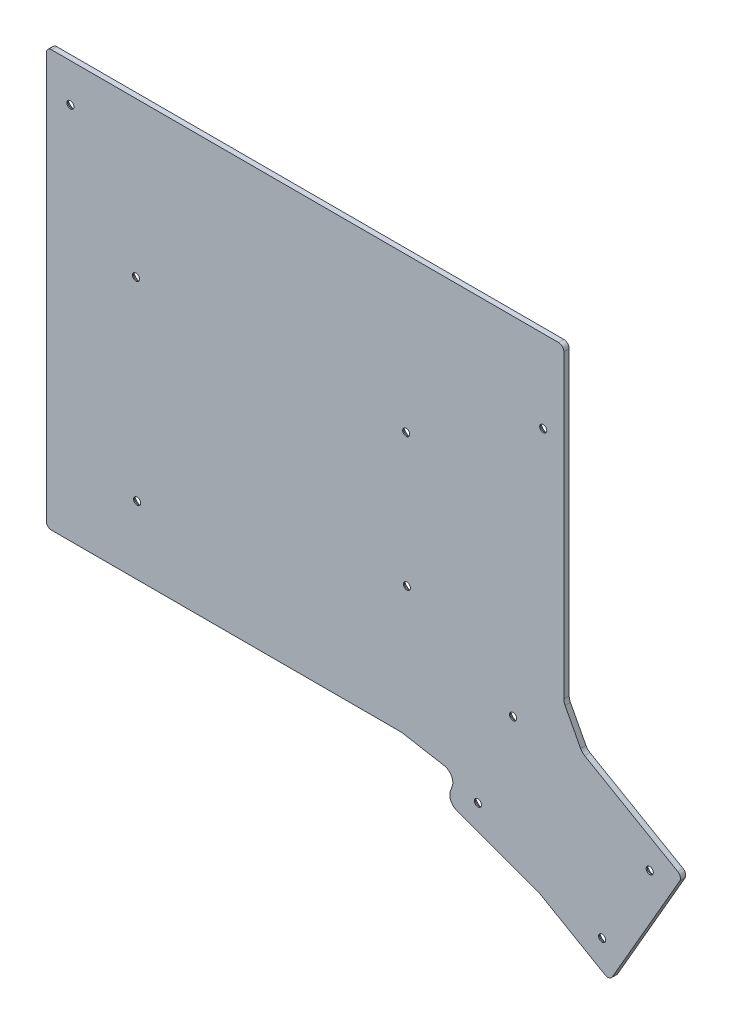
from build123d import *

# Parameters (mm, degrees)
BOSS_EXTRUDE1_DEPTH = 1.5
SKETCH6_R           = 1
CUT_EXTRUDE1_DEPTH  = 10
FILLET4_R           = 1.5
FILLET5_R           = 3


# Read off the part's stored shape, not the designer's step: AdvancedHole1
with BuildPart() as part:
    # Sketch1 → Boss-Extrude1 (new body)
    with BuildSketch(Plane.XY):
        Polygon((-132.514999879, 63.173696093), (13.284995002, 63.173696093), (13.284995002, -23.784888353), (18.416457767, -33.534813854), (46.668669763, -49.846236055), (26.202746282, -85.294255348), (6.148371034, -73.7158564), (-19.700470814, -64.307647377), (-16.953396025, -56.760121426), (-32.457645619, -54.026303907), (-132.514999879, -54.026303907), align=None)
    extrude(amount=BOSS_EXTRUDE1_DEPTH)

    # Sketch6 → Cut-Extrude1 (cut)
    with BuildSketch(Plane(origin=(0, 0, 0), x_dir=(-1, 0, 0), z_dir=(0, 0, -1))):
        with Locations((125.729523879, 52.403696093)):
            Circle(SKETCH6_R)
        with Locations((106.929523879, -34.896303907)):
            Circle(SKETCH6_R)
        with Locations((30.929523879, -17.596303907)):
            Circle(SKETCH6_R)
        with Locations((31.129523879, 19.803696093)):
            Circle(SKETCH6_R)
        with Locations((-7.470476121, 40.003696093)):
            Circle(SKETCH6_R)
        with Locations((1.029523879, -34.496303907)):
            Circle(SKETCH6_R)
        with Locations((10.929523879, -60.496303907)):
            Circle(SKETCH6_R)
        with Locations((-37.470476121, -52.796303907)):
            Circle(SKETCH6_R)
        with Locations((-24.070476121, -75.996303907)):
            Circle(SKETCH6_R)
        with Locations((107.229523879, 19.603696093)):
            Circle(SKETCH6_R)
    extrude(amount=-CUT_EXTRUDE1_DEPTH, mode=Mode.SUBTRACT)

    # AdvancedHole1 outline → AdvancedHole1 (revolve, cut)
    with BuildSketch(Plane(origin=(37.470476121, -52.796303907, 0), x_dir=(1, 0, 0), z_dir=(0, -1, 0))):
        Polygon((2.2, 0), (1, 1.2), (1, 0), align=None)
    revolve(axis=Axis((37.470476121, -52.796303907, 0), (0, 0, 1)), mode=Mode.SUBTRACT)

    # AdvancedHole1 2 outline → AdvancedHole1 2 (revolve, cut)
    with BuildSketch(Plane(origin=(24.070476121, -75.996303907, 0), x_dir=(1, 0, 0), z_dir=(0, -1, 0))):
        Polygon((2.2, 0), (1, 1.2), (1, 0), align=None)
    revolve(axis=Axis((24.070476121, -75.996303907, 0), (0, 0, 1)), mode=Mode.SUBTRACT)

    # AdvancedHole1 3 outline → AdvancedHole1 3 (revolve, cut)
    with BuildSketch(Plane(origin=(-10.929523879, -60.496303907, 0), x_dir=(1, 0, 0), z_dir=(0, -1, 0))):
        Polygon((2.2, 0), (1, 1.2), (1, 0), align=None)
    revolve(axis=Axis((-10.929523879, -60.496303907, 0), (0, 0, 1)), mode=Mode.SUBTRACT)

    # AdvancedHole1 4 outline → AdvancedHole1 4 (revolve, cut)
    with BuildSketch(Plane(origin=(-1.029523879, -34.496303907, 0), x_dir=(1, 0, 0), z_dir=(0, -1, 0))):
        Polygon((2.2, 0), (1, 1.2), (1, 0), align=None)
    revolve(axis=Axis((-1.029523879, -34.496303907, 0), (0, 0, 1)), mode=Mode.SUBTRACT)

    # AdvancedHole1 5 outline → AdvancedHole1 5 (revolve, cut)
    with BuildSketch(Plane(origin=(-30.929523879, -17.596303907, 0), x_dir=(1, 0, 0), z_dir=(0, -1, 0))):
        Polygon((2.2, 0), (1, 1.2), (1, 0), align=None)
    revolve(axis=Axis((-30.929523879, -17.596303907, 0), (0, 0, 1)), mode=Mode.SUBTRACT)

    # AdvancedHole1 6 outline → AdvancedHole1 6 (revolve, cut)
    with BuildSketch(Plane(origin=(-106.929523879, -34.896303907, 0), x_dir=(1, 0, 0), z_dir=(0, -1, 0))):
        Polygon((2.2, 0), (1, 1.2), (1, 0), align=None)
    revolve(axis=Axis((-106.929523879, -34.896303907, 0), (0, 0, 1)), mode=Mode.SUBTRACT)

    # AdvancedHole1 7 outline → AdvancedHole1 7 (revolve, cut)
    with BuildSketch(Plane(origin=(-125.729523879, 52.403696093, 0), x_dir=(1, 0, 0), z_dir=(0, -1, 0))):
        Polygon((2.2, 0), (1, 1.2), (1, 0), align=None)
    revolve(axis=Axis((-125.729523879, 52.403696093, 0), (0, 0, 1)), mode=Mode.SUBTRACT)

    # AdvancedHole1 8 outline → AdvancedHole1 8 (revolve, cut)
    with BuildSketch(Plane(origin=(-31.129523879, 19.803696093, 0), x_dir=(1, 0, 0), z_dir=(0, -1, 0))):
        Polygon((2.2, 0), (1, 1.2), (1, 0), align=None)
    revolve(axis=Axis((-31.129523879, 19.803696093, 0), (0, 0, 1)), mode=Mode.SUBTRACT)

    # AdvancedHole1 9 outline → AdvancedHole1 9 (revolve, cut)
    with BuildSketch(Plane(origin=(-107.229523879, 19.603696093, 0), x_dir=(1, 0, 0), z_dir=(0, -1, 0))):
        Polygon((2.2, 0), (1, 1.2), (1, 0), align=None)
    revolve(axis=Axis((-107.229523879, 19.603696093, 0), (0, 0, 1)), mode=Mode.SUBTRACT)

    # AdvancedHole1 10 outline → AdvancedHole1 10 (revolve, cut)
    with BuildSketch(Plane(origin=(7.470476121, 40.003696093, 0), x_dir=(1, 0, 0), z_dir=(0, -1, 0))):
        Polygon((2.2, 0), (1, 1.2), (1, 0), align=None)
    revolve(axis=Axis((7.470476121, 40.003696093, 0), (0, 0, 1)), mode=Mode.SUBTRACT)

    # Fillet4
    fillet4_edges = [part.edges().sort_by_distance(p)[0] for p in [
        (-132.514999879, 63.173696093, 0.75),
        (13.284995002, 63.173696093, 0.75),
        (46.668669763, -49.846236055, 0.75),
        (26.202746282, -85.294255348, 0.75),
        (-132.514999879, -54.026303907, 0.75),
    ]]
    fillet(fillet4_edges, radius=FILLET4_R)

    # Fillet5
    fillet5_edges = [part.edges().sort_by_distance(p)[0] for p in [
        (13.284995002, -23.784888353, 0.75),
        (18.416457767, -33.534813854, 0.75),
        (-19.700470814, -64.307647377, 0.75),
        (-16.953396025, -56.760121426, 0.75),
        (-32.457645619, -54.026303907, 0.75),
    ]]
    fillet(fillet5_edges, radius=FILLET5_R)


solid = part.part
